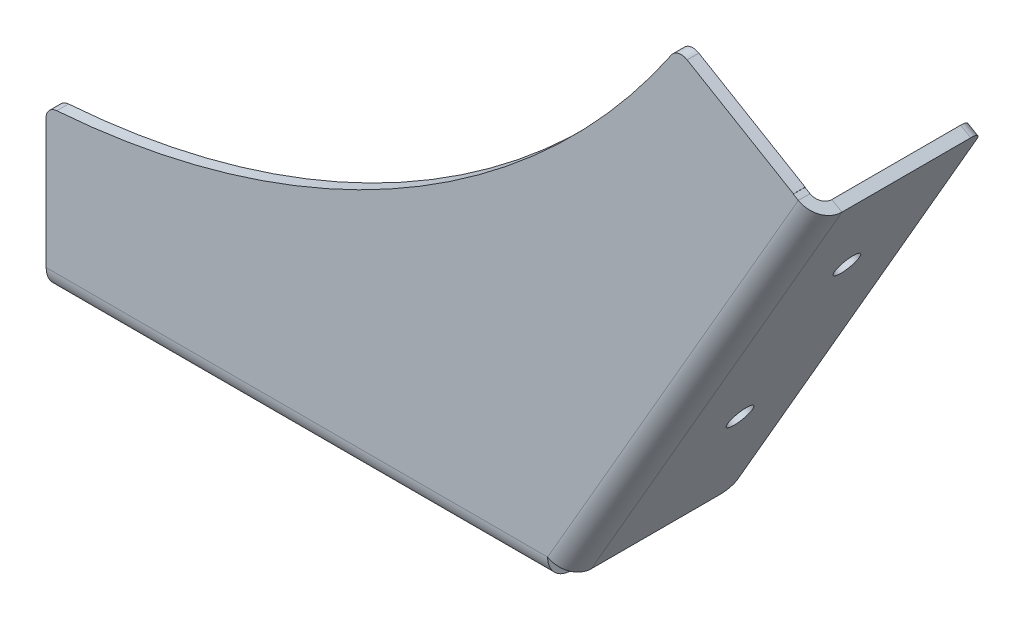
from build123d import *

# Parameters (mm, degrees)
BASE_FLANGE1_START       = -3.175
BASE_FLANGE1_DEPTH       = 3.175
EDGE_FLANGE1_START       = -0.3353435
EDGE_FLANGE1_DEPTH       = 0.3353435
EDGE_FLANGE1_START_2     = -3.175
EDGE_FLANGE1_2_DEPTH     = 3.175
EDGE_FLANGE1_START_3     = -44.45
EDGE_FLANGE1_3_OUTLINE_W = 136.033825791
EDGE_FLANGE1_3_OUTLINE_H = 3.175
EDGE_FLANGE1_3_DEPTH     = 38.1
EDGE_FLANGE1_START_4     = -139.7
EDGE_FLANGE1_4_DEPTH     = 136.033825791
EDGE_FLANGE1_START_5     = 3.666174209
EDGE_FLANGE1_5_DEPTH     = 136.033825791
EDGE_FLANGE1_6_DEPTH     = 146.096388787
EDGE_FLANGE1_START_6     = -69.85
EDGE_FLANGE1_7_DEPTH     = 209.55
FILLET2_R                = 220.82
SKETCH15_R               = 3.3734375
CUT_EXTRUDE1_DEPTH       = 206.261094571
SKETCH16_R               = 3.3734375
CUT_EXTRUDE2_DEPTH       = 206.261094571
FILLET3_R                = 3.175


with BuildPart() as part:
    # Base-Flange1: read off the stored shape, not the designer's step
    # Base-Flange1 outline → Base-Flange1 (new body)
    with BuildSketch(Plane.XY.offset(BASE_FLANGE1_START)):
        Polygon((69.85, 120.983748909), (31.595939562, 143.620651524), (-25.447777456, 44.572661394), (-139.747711611, 44.449974394), (-139.7, 0), (0, 0), align=None)
    extrude(amount=BASE_FLANGE1_DEPTH)

    # Edge-Flange1: read off the stored shape, not the designer's step
    # Edge-Flange1 outline → Edge-Flange1 (cut)
    with BuildSketch(Plane.XY.offset(EDGE_FLANGE1_START)):
        Polygon((-139.7, 7.9375), (-139.708519936, 7.9375), (-139.7, 0), (0, 0), (1.833087105, 3.175), (69.85, 120.983748909), (63.01852425, 125.026285819), (62.975923357, 124.952498909), (64.350738686, 124.158748909), (67.100369343, 122.571248909), (-0.916543552, 4.7625), (-3.666174209, 6.35), (-3.666174209, 3.175), (-139.7, 3.175), align=None)
    extrude(amount=EDGE_FLANGE1_DEPTH, mode=Mode.SUBTRACT)

    # Edge-Flange1 2 outline → Edge-Flange1 2 (cut)
    with BuildSketch(Plane.XY.offset(EDGE_FLANGE1_START_2)):
        Polygon((-139.7, 7.9375), (-139.708519936, 7.9375), (-139.7, 0), align=None)
        Polygon((-3.666174209, 6.35), (-3.666174209, 0), (0, 0), (1.833087105, 3.175), align=None)
        Polygon((64.350738686, 124.158748909), (69.85, 120.983748909), (63.01852425, 125.026285819), (62.975923357, 124.952498909), align=None)
    extrude(amount=EDGE_FLANGE1_2_DEPTH, mode=Mode.SUBTRACT)



with BuildPart() as body_2:
    # Edge-Flange1 3 outline → Edge-Flange1 3 (new body)
    with BuildSketch(Plane.XY.offset(EDGE_FLANGE1_START_3)):
        with Locations((-71.683087105, 1.5875)):
            Rectangle(EDGE_FLANGE1_3_OUTLINE_W, EDGE_FLANGE1_3_OUTLINE_H)
        Polygon((-0.916543552, 4.7625), (1.833087105, 3.175), (69.85, 120.983748909), (67.100369343, 122.571248909), align=None)
    extrude(amount=EDGE_FLANGE1_3_DEPTH)


with BuildPart() as part_1:
    add(part.part)

    add(body_2.part)  # Edge-Flange1 4 merges body 2
    # Edge-Flange1 4 outline → Edge-Flange1 4 (add)
    with BuildSketch(Plane.YZ.offset(EDGE_FLANGE1_START_4)):
        with BuildLine():
            ThreePointArc((0.850738685, -3.175), (0.216371003, -4.706499064), (0, -6.35))
            Line((0, -6.35), (3.175, -6.35))
            ThreePointArc((3.175, -6.35), (4.10493597, -4.10493597), (6.35, -3.175))
            Line((6.35, -3.175), (0.850738685, -3.175))
        make_face()
    extrude(amount=EDGE_FLANGE1_4_DEPTH)

    # Edge-Flange1 5 outline → Edge-Flange1 5 (add)
    with BuildSketch(Plane(origin=(0, 0, 0), x_dir=(0.866025403784418, -0.500000000000036, 0), z_dir=(0.500000000000036, 0.866025403784418, 0)).offset(EDGE_FLANGE1_START_5)):
        with BuildLine():
            ThreePointArc((-0.850738685, 3.175), (-0.216371003, 4.706499064), (0, 6.35))
            Line((0, 6.35), (-3.175, 6.35))
            ThreePointArc((-3.175, 6.35), (-4.10493597, 4.10493597), (-6.35, 3.175))
            Line((-6.35, 3.175), (-0.850738685, 3.175))
        make_face()
    extrude(amount=EDGE_FLANGE1_5_DEPTH)

    # Edge-Flange1 6 outline → Edge-Flange1 6 (cut)
    with BuildSketch(Plane.YZ.offset(EDGE_FLANGE1_START_4)):
        with BuildLine():
            Line((0, -3.175), (0.850738685, -3.175))
            ThreePointArc((0.850738685, -3.175), (3.174999999, -0.850738686), (6.35, 0))
            Line((6.35, 0), (3.175, 0))
            Line((3.175, 0), (3.175, -0.3353435))
            Line((3.175, -0.3353435), (0, -0.3353435))
            Line((0, -0.3353435), (0, -3.175))
        make_face()
    extrude(amount=EDGE_FLANGE1_6_DEPTH, mode=Mode.SUBTRACT)

    # Edge-Flange1 7 outline → Edge-Flange1 7 (cut)
    with BuildSketch(Plane(origin=(0, 0, 0), x_dir=(0.866025403784418, -0.500000000000036, 0), z_dir=(0.500000000000036, 0.866025403784418, 0)).offset(EDGE_FLANGE1_START_6)):
        with BuildLine():
            Line((0, 3.175), (-0.850738685, 3.175))
            ThreePointArc((-0.850738685, 3.175), (-3.174999999, 0.850738686), (-6.35, 0))
            Line((-6.35, 0), (-3.175, 0))
            Line((-3.175, 0), (-3.175, 0.3353435))
            Line((-3.175, 0.3353435), (0, 0.3353435))
            Line((0, 0.3353435), (0, 3.175))
        make_face()
    extrude(amount=EDGE_FLANGE1_7_DEPTH, mode=Mode.SUBTRACT)

    # Fillet2
    # the kernel refuses this fillet: 220.82 mm, written as the material it adds along each edge
    with BuildSketch(Plane(origin=(-25.447777456, 44.572661394, -3.175), x_dir=(0.49907014013952505, 0.8665615934376014, 0), z_dir=(0, 0, 1))) as fillet2_piece_1:
        with BuildLine():
            CenterArc((127.27037084, 220.438748591), FILLET2_R, 213.36733761, 53.265324779)
            Line((-57.149999999, 98.986703653), (0, 0))
            Line((0, 0), (114.3, 0))
        make_face()
    extrude(amount=3.175)

    # Sketch15 → Cut-Extrude1 (cut, through all)
    with BuildSketch(Plane(origin=(0, 0, 0), x_dir=(0, 0, -1), z_dir=(0.8660254037844249, -0.5000000000000239, 3.506248131957107e-15))):
        with Locations(Location((25.4, 104.22382, 0), (0, 0, 90))):
            Circle(SKETCH15_R)
        with Locations(Location((25.4, 46.284161604, 0), (0, 0, 90))):
            Circle(SKETCH15_R)
    extrude(amount=-CUT_EXTRUDE1_DEPTH, mode=Mode.SUBTRACT)

    # Sketch16 → Cut-Extrude2 (cut, through all)
    with BuildSketch(Plane.XZ):
        with Locations(Location((-104.22382, -25.4, 0), (0, 0, 270))):
            Circle(SKETCH16_R)
        with Locations(Location((-46.284161686, -25.4, 0), (0, 0, 270))):
            Circle(SKETCH16_R)
    extrude(amount=-CUT_EXTRUDE2_DEPTH, mode=Mode.SUBTRACT)

    # Fillet3
    fillet3_edges = [part_1.edges().sort_by_distance(p)[0] for p in [
        (31.595939562, 143.620651524, -1.5875),
        (-139.747711611, 44.449974394, -1.5875),
        (-3.666174209, 1.5875, -44.45),
        (-139.7, 1.5875, -44.45),
        (68.475184671, 121.777498909, -44.45),
        (0.458271776, 3.96875, -44.45),
    ]]
    fillet(fillet3_edges, radius=FILLET3_R)


solid = part_1.part
